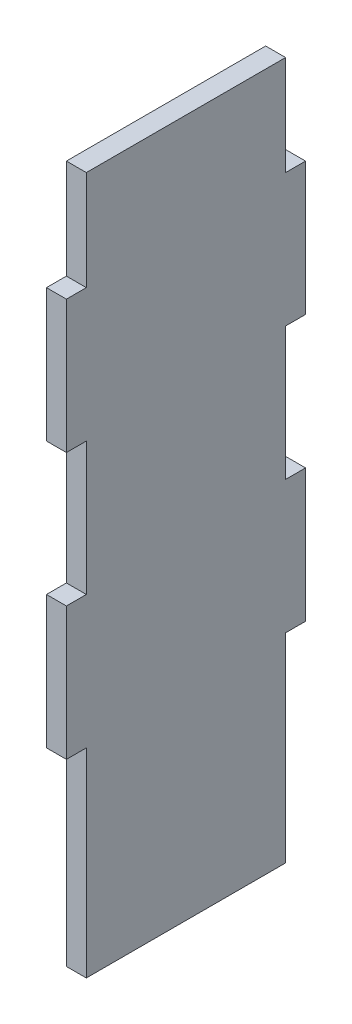
from build123d import *

# Parameters (mm, degrees)
BOSS_EXTRUDE1_DEPTH = 3


with BuildPart() as part:
    # Sketch1 → Boss-Extrude1 (new body)
    with BuildSketch(Plane(origin=(0, 0, 0), x_dir=(0, 0, -1), z_dir=(1, 0, 0))):
        Polygon((-15, 0), (15, 0), (15, 30), (18, 30), (18, 50), (15, 50), (15, 70), (18, 70), (18, 90), (15, 90), (15, 105), (-15, 105), (-15, 90), (-18, 90), (-18, 70), (-15, 70), (-15, 50), (-18, 50), (-18, 30), (-15, 30), align=None)
    extrude(amount=BOSS_EXTRUDE1_DEPTH)


solid = part.part
